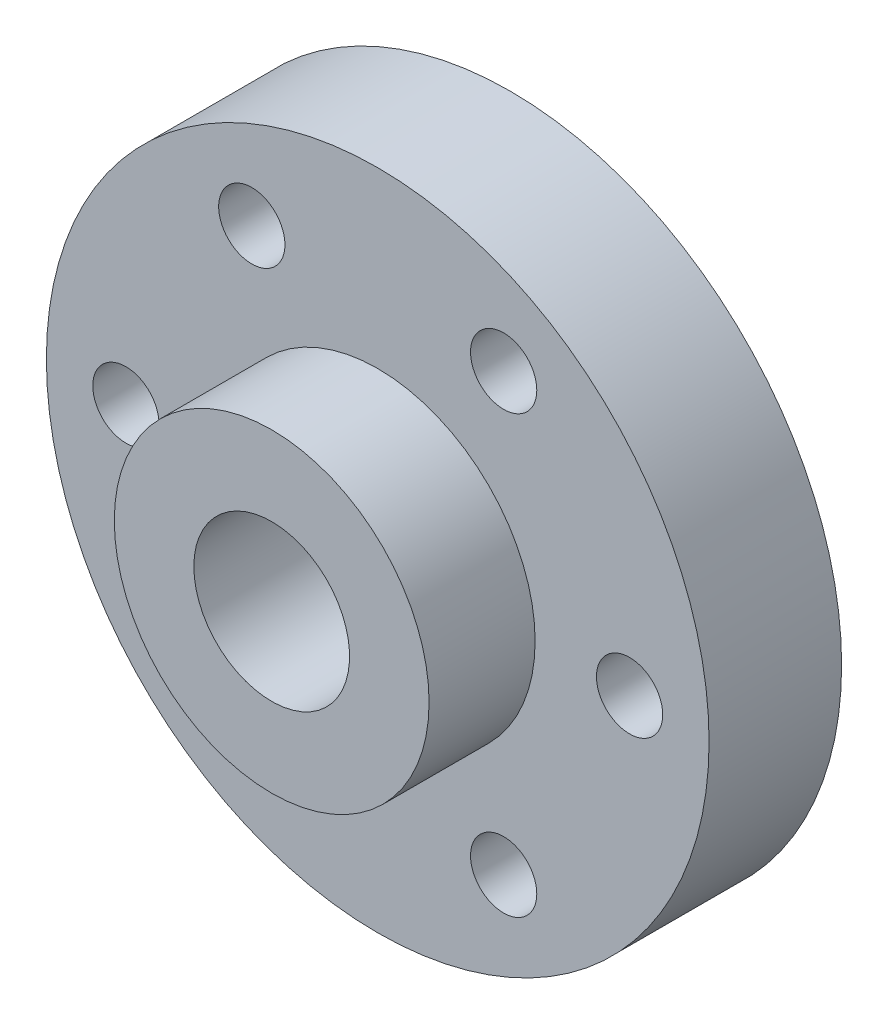
from build123d import *

# Parameters (mm, degrees)
SKETCH1_R           = 12.7
BOSS_EXTRUDE1_DEPTH = 5.08
SKETCH2_R           = 6.0325
BOSS_EXTRUDE2_DEPTH = 4.064
SKETCH3_R           = 2.9845
CUT_EXTRUDE1_DEPTH  = 21.154223776
SKETCH4_R           = 1.27
CUT_EXTRUDE2_DEPTH  = 21.154223776
CIRPATTERN1_COUNT   = 6


with BuildPart() as part:
    # Sketch1 → Boss-Extrude1 (new body)
    with BuildSketch(Plane.XY):
        Circle(SKETCH1_R)
    extrude(amount=BOSS_EXTRUDE1_DEPTH)

    # Sketch2 → Boss-Extrude2 (add)
    with BuildSketch(Plane.XY.offset(5.08)):
        Circle(SKETCH2_R)
    extrude(amount=BOSS_EXTRUDE2_DEPTH)

    # Sketch3 → Cut-Extrude1 (cut, through all)
    with BuildSketch(Plane(origin=(0, 0, 0), x_dir=(-1, 0, 0), z_dir=(0, 0, -1))):
        Circle(SKETCH3_R)
    extrude(amount=-CUT_EXTRUDE1_DEPTH, mode=Mode.SUBTRACT)

    # Sketch4 → Cut-Extrude2 (cut, through all)
    with BuildSketch(Plane(origin=(0, 0, 0), x_dir=(-1, 0, 0), z_dir=(0, 0, -1))):
        with Locations((9.652, 0)):
            Circle(SKETCH4_R)
    cut_extrude2 = extrude(amount=-CUT_EXTRUDE2_DEPTH, mode=Mode.SUBTRACT)

    # CirPattern1: Cut-Extrude2 ×6 about axis
    cirpattern1_axis = Axis((0, 0, 9.144), (0, 0, -1))
    for i in range(1, CIRPATTERN1_COUNT):
        add(cut_extrude2.rotate(cirpattern1_axis, i * 360 / CIRPATTERN1_COUNT), mode=Mode.SUBTRACT)


solid = part.part
